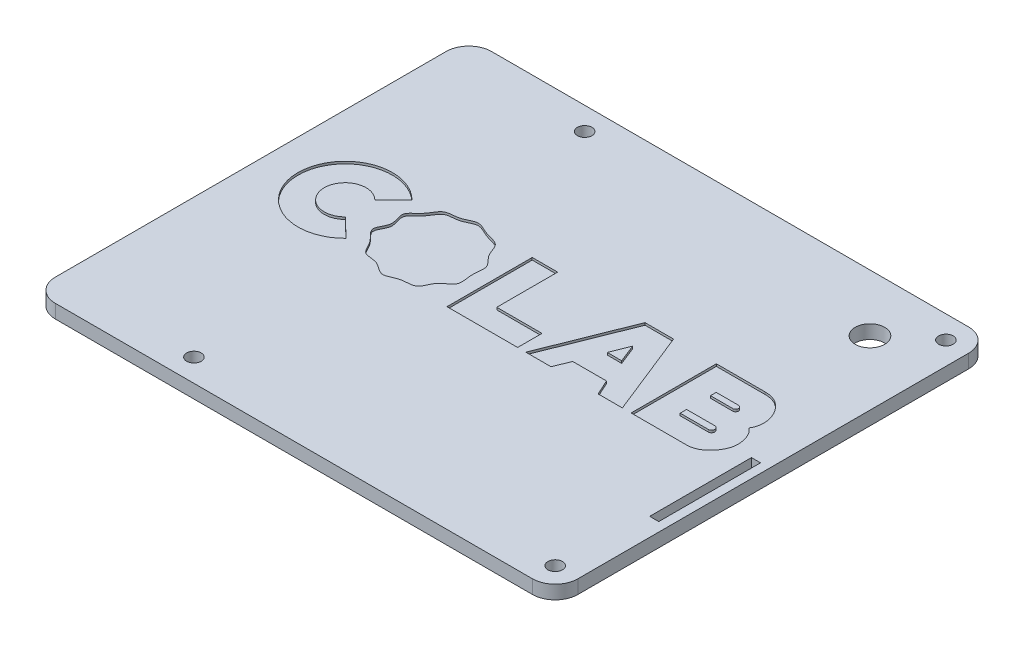
from build123d import *

# Parameters (mm, degrees)
BOSS_EXTRUDE1_DEPTH     = 3
CUT_EXTRUDE2_DEPTH      = 150.833240638
CUT_EXTRUDE2_DEPTH_BACK = 150.833240638
SKETCH3_R               = 1.6
CUT_EXTRUDE3_DEPTH      = 150.833240638
CUT_EXTRUDE3_DEPTH_BACK = 150.833240638
SKETCH5_W               = 2
SKETCH5_H               = 22.4
SKETCH6_R               = 3.5
SKETCH6_R_2             = 1.45
BOSS_EXTRUDE2_DEPTH     = 5
SKETCH8_R               = 3.25
CUT_EXTRUDE5_DEPTH      = 151.016665741
CUT_EXTRUDE10_START     = -0.5
CUT_EXTRUDE10_DEPTH     = 0.5


# Read off the part's stored shape, not the designer's step: Cut-Extrude10
with BuildPart() as part:
    # Sketch1 → Boss-Extrude1 (new body)
    with BuildSketch(Plane(origin=(0, 0, 0), x_dir=(1, 0, 0), z_dir=(0, 1, 0))):
        with BuildLine():
            Line((5, 0), (110, 0))
            ThreePointArc((110, 0), (113.535533906, 1.464466094), (115, 5))
            Line((115, 5), (115, 91))
            ThreePointArc((115, 91), (113.535533906, 94.535533906), (110, 96))
            Line((110, 96), (5, 96))
            ThreePointArc((5, 96), (1.464466094, 94.535533906), (0, 91))
            Line((0, 91), (0, 5))
            ThreePointArc((0, 5), (1.464466094, 1.464466094), (5, 0))
        make_face()
    extrude(amount=BOSS_EXTRUDE1_DEPTH)

    # Sketch3 → Cut-Extrude2 (cut, two sides: drawn at the far end of the back side and taken through both)
    with BuildSketch(Plane.XZ.offset(-CUT_EXTRUDE2_DEPTH_BACK)):
        with Locations(Location((30.5, -91, 0), (0, 0, 270))):
            Circle(SKETCH3_R)
        with Locations(Location((110, -91, 0), (0, 0, 270))):
            Circle(SKETCH3_R)
        with Locations(Location((110, -5, 0), (0, 0, 270))):
            Circle(SKETCH3_R)
        with Locations(Location((30.5, -5, 0), (0, 0, 270))):
            Circle(SKETCH3_R)
    extrude(amount=CUT_EXTRUDE2_DEPTH + CUT_EXTRUDE2_DEPTH_BACK, mode=Mode.SUBTRACT)

    # Sketch5 → Cut-Extrude3 (cut, two sides: drawn at the far end of the back side and taken through both)
    with BuildSketch(Plane(origin=(0, 3, 0), x_dir=(1, 0, 0), z_dir=(0, 1, 0)).offset(-CUT_EXTRUDE3_DEPTH_BACK)):
        with Locations((112, 36)):
            Rectangle(SKETCH5_W, SKETCH5_H)
    extrude(amount=CUT_EXTRUDE3_DEPTH + CUT_EXTRUDE3_DEPTH_BACK, mode=Mode.SUBTRACT)

    # Sketch6 → Boss-Extrude2 (add)
    # profile 1 of 5: a face of its own
    with BuildSketch(Plane.XZ):
        with Locations(Location((12.34, -37.36, 0), (0, 0, 270))):
            Circle(SKETCH6_R)
        with Locations(Location((12.34, -37.36, 0), (0, 0, 270))):
            Circle(SKETCH6_R_2, mode=Mode.SUBTRACT)
    # profile 2 of 5: a face of its own
    with BuildSketch(Plane.XZ):
        with Locations(Location((31.14, -20.6, 0), (0, 0, 270))):
            Circle(SKETCH6_R)
        with Locations(Location((31.14, -20.6, 0), (0, 0, 270))):
            Circle(SKETCH6_R_2, mode=Mode.SUBTRACT)
    # profile 3 of 5: a face of its own
    with BuildSketch(Plane.XZ):
        with Locations(Location((80, -23, 0), (0, 0, 270))):
            Circle(SKETCH6_R)
        with Locations(Location((80, -23, 0), (0, 0, 270))):
            Circle(SKETCH6_R_2, mode=Mode.SUBTRACT)
    # profile 4 of 5: a face of its own
    with BuildSketch(Plane.XZ):
        with Locations(Location((55, -58.7, 0), (0, 0, 270))):
            Circle(SKETCH6_R)
        with Locations(Location((55, -58.7, 0), (0, 0, 270))):
            Circle(SKETCH6_R_2, mode=Mode.SUBTRACT)
    # profile 5 of 5: a face of its own
    with BuildSketch(Plane.XZ):
        with Locations(Location((92, -60, 0), (0, 0, 270))):
            Circle(SKETCH6_R)
        with Locations(Location((92, -60, 0), (0, 0, 270))):
            Circle(SKETCH6_R_2, mode=Mode.SUBTRACT)
    extrude(amount=BOSS_EXTRUDE2_DEPTH)

    # Sketch8 → Cut-Extrude5 (cut, through all)
    with BuildSketch(Plane(origin=(0, 3, 0), x_dir=(1, 0, 0), z_dir=(0, 1, 0))):
        with Locations(Location((100.830700964, 83.447928687, 0), (0, 0, 270))):
            Circle(SKETCH8_R)
    extrude(amount=-CUT_EXTRUDE5_DEPTH, mode=Mode.SUBTRACT)

    # Cut-Extrude10 outline → Cut-Extrude10 (cut)
    # profile 1 of 5: a face of its own
    with BuildSketch(Plane(origin=(0, 3, 0), x_dir=(1, 0, 0), z_dir=(0, 1, 0)).offset(CUT_EXTRUDE10_START)):
        with BuildLine():
            add(Edge.make_bspline(
                [(33.297546512, 60.762111078), (34.321493225, 61.048834598), (36.18852417, 62.550801835), (39.070738928, 60.462755537), (42.712636812, 60.208352882), (43.144004006, 56.602527257), (46.09833526, 54.669098205), (45.006476912, 51.26118059), (46.336556679, 47.589715296), (42.682432836, 46.184375587), (42.072894551, 42.321191178), (38.279932777, 42.959244425), (35.262379734, 40.642228973), (32.814739239, 43.620013549), (29.131791016, 43.12301619), (28.257625721, 46.713581483), (24.638110416, 48.904686116), (27.648013187, 52.086935615), (25.349884181, 55.492167671), (28.714558965, 57.399923404), (29.840222465, 60.781714479), (32.27004315, 60.474391631), (33.297546512, 60.762111078)],
                knots=[0, 0, 0, 0, 0.047565866, 0.099485372, 0.14962398, 0.198942511, 0.245793773, 0.294983717, 0.351097127, 0.397671231, 0.448622997, 0.49991252, 0.548427096, 0.601372094, 0.646990452, 0.695732934, 0.75340056, 0.801073119, 0.852346593, 0.899993152, 0.952268916, 1, 1, 1, 1], degree=3))
        make_face()
    # profile 2 of 5: a face of its own
    with BuildSketch(Plane(origin=(0, 3, 0), x_dir=(1, 0, 0), z_dir=(0, 1, 0)).offset(CUT_EXTRUDE10_START)):
        with BuildLine():
            add(Edge.make_bspline(
                [(99.964766601, 61.220545167), (100.791800419, 61.220545167), (102.365079498, 60.960449653), (103.919562133, 59.691685536), (104.957768655, 58.295336972), (105.985657449, 56.088458462), (105.896217849, 53.802166915), (105.066743657, 52.572435992)],
                knots=[0, 0, 0, 0, 0.198500718, 0.395419287, 0.481006054, 0.634425351, 1, 1, 1, 1], degree=3))
            Line((99.964766601, 61.220545167), (89.256491407, 61.220545167))
            Line((89.256491407, 61.220545167), (89.256491407, 42.459618206))
            Line((89.256491407, 42.459618206), (101.719296112, 42.459618206))
            add(Edge.make_bspline(
                [(101.719296112, 42.459618206), (103.54789728, 42.555591833), (105.687893164, 44.259558049), (107.07317679, 47.24879867), (106.917803922, 49.989164315), (106.110293292, 51.843021102), (105.066743657, 52.572435992)],
                knots=[0, 0, 0, 0, 0.392551362, 0.572802732, 0.719790987, 1, 1, 1, 1], degree=3))
        make_face()
        with BuildLine():
            Line((100.884956632, 47.819883052), (94.693178468, 47.819883052))
            Line((94.693178468, 47.819883052), (94.693178468, 49.239355876))
            Line((94.693178468, 49.239355876), (100.884956632, 49.239355876))
            ThreePointArc((100.884956632, 49.239355876), (101.594693044, 48.529619464), (100.884956632, 47.819883052))
        make_face(mode=Mode.SUBTRACT)
        with BuildLine():
            Line((94.693178468, 54.49229736), (94.693178468, 55.750824339))
            Line((94.693178468, 55.750824339), (99.591229416, 55.750824339))
            ThreePointArc((99.591229416, 55.750824339), (100.220492906, 55.121560849), (99.591229416, 54.49229736))
            Line((99.591229416, 54.49229736), (94.693178468, 54.49229736))
        make_face(mode=Mode.SUBTRACT)
    # profile 3 of 5: a face of its own
    with BuildSketch(Plane(origin=(0, 3, 0), x_dir=(1, 0, 0), z_dir=(0, 1, 0)).offset(CUT_EXTRUDE10_START)):
        with BuildLine():
            Line((24.604540144, 44.382816286), (20.424423017, 48.381106705))
            ThreePointArc((20.424423017, 48.381106705), (12.555614195, 51.633082316), (20.425070456, 54.883490876))
            Line((20.425070456, 54.883490876), (24.535811062, 58.952326397))
            ThreePointArc((24.535811062, 58.952326397), (6.771833422, 51.583610816), (24.604540144, 44.382816286))
        make_face()
    # profile 4 of 5: a face of its own
    with BuildSketch(Plane(origin=(0, 3, 0), x_dir=(1, 0, 0), z_dir=(0, 1, 0)).offset(CUT_EXTRUDE10_START)):
        Polygon((64.279295174, 47.819883052), (54.324517603, 47.819883052), (54.324517603, 61.220545167), (48.734527121, 61.220545167), (48.734527121, 42.459618206), (64.279295174, 42.459618206), align=None)
    # profile 5 of 5: a face of its own
    with BuildSketch(Plane(origin=(0, 3, 0), x_dir=(1, 0, 0), z_dir=(0, 1, 0)).offset(CUT_EXTRUDE10_START)):
        Polygon((80.447099228, 45.850476979), (82.001118719, 42.459618206), (87.332392702, 42.459618206), (79.844494259, 61.212980487), (73.562845062, 61.212980487), (66.081854559, 42.459618206), (71.643767403, 42.459618206), (72.996430562, 45.850476979), align=None)
        Polygon((76.683077803, 55.362370529), (78.274991903, 51.37543854), (75.09263232, 51.37543854), align=None, mode=Mode.SUBTRACT)
    extrude(amount=CUT_EXTRUDE10_DEPTH, mode=Mode.SUBTRACT)


solid = part.part
